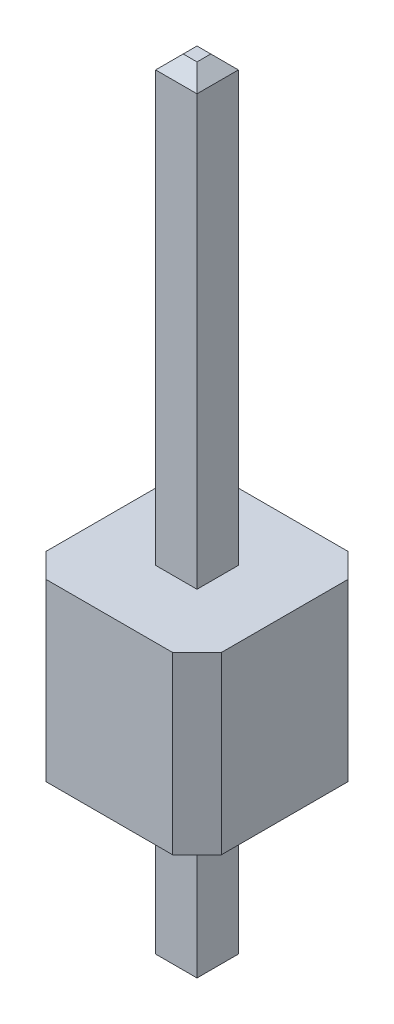
from build123d import *

# Parameters (mm, degrees)
SKETCH3_W           = 0.6
SKETCH3_H           = 0.6
BOSS_EXTRUDE3_DEPTH = 11.5
CHAMFER2_SIZE       = 0.2
BOSS_EXTRUDE4_DEPTH = 2.54


with BuildPart() as part:
    # Sketch3 → Boss-Extrude3 (new body)
    with BuildSketch(Plane(origin=(0, 0, 0), x_dir=(1, 0, 0), z_dir=(0, 1, 0))):
        Rectangle(SKETCH3_W, SKETCH3_H)
    extrude(amount=BOSS_EXTRUDE3_DEPTH)

    # Chamfer2
    chamfer2_edges = [part.edges().sort_by_distance(p)[0] for p in [
        (0, 11.5, -0.3),
        (0.3, 11.5, 0),
        (0, 11.5, 0.3),
        (-0.3, 11.5, 0),
        (0, 0, 0.3),
        (0.3, 0, 0),
        (0, 0, -0.3),
        (-0.3, 0, 0),
    ]]
    chamfer(chamfer2_edges, length=CHAMFER2_SIZE)

    # Sketch2 → Boss-Extrude4 (add)
    with BuildSketch(Plane(origin=(0, 2.54, 0), x_dir=(1, 0, 0), z_dir=(0, 1, 0))):
        Polygon((-0.916446609, 1.27), (-1.27, 0.916446609), (-1.27, -0.916446609), (-0.916446609, -1.27), (0.916446609, -1.27), (1.27, -0.916446609), (1.27, 0.916446609), (0.916446609, 1.27), align=None)
    extrude(amount=BOSS_EXTRUDE4_DEPTH)


solid = part.part
